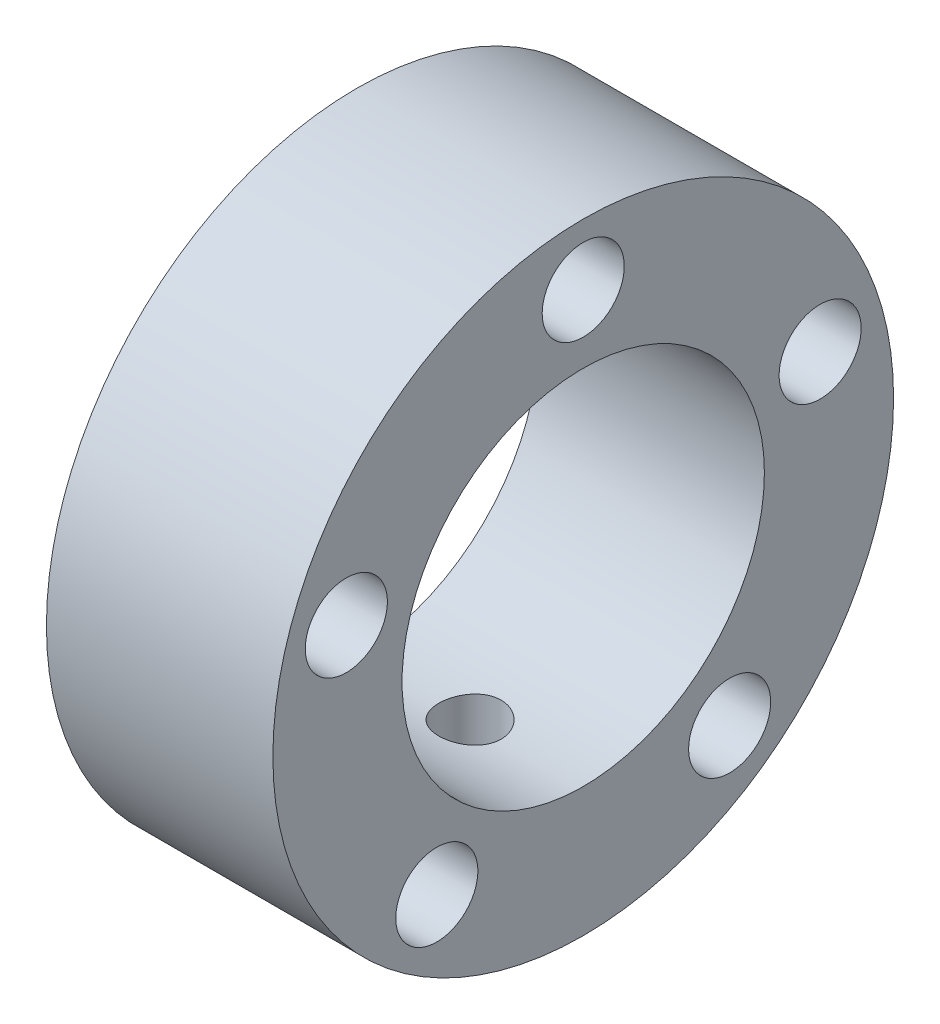
from build123d import *

# Parameters (mm, degrees)
SKETCH1_R           = 13.924461334
SKETCH1_R_2         = 8.128
BOSS_EXTRUDE1_DEPTH = 10.16
SKETCH2_R           = 1.8415
CUT_EXTRUDE1_DEPTH  = 23.158674304
SKETCH3_R           = 1.397
CUT_EXTRUDE2_DEPTH  = 23.158674304


with BuildPart() as part:
    # Sketch1 → Boss-Extrude1 (new body)
    with BuildSketch(Plane(origin=(0, 0, 0), x_dir=(0, 0, -1), z_dir=(1, 0, 0))):
        Circle(SKETCH1_R)
        Circle(SKETCH1_R_2, mode=Mode.SUBTRACT)
    extrude(amount=BOSS_EXTRUDE1_DEPTH)

    # Sketch2 → Cut-Extrude1 (cut, through all)
    with BuildSketch(Plane.ZY):
        with Locations((0, 11.176)):
            Circle(SKETCH2_R)
        with Locations((10.629007626, 3.453573929)):
            Circle(SKETCH2_R)
        with Locations((6.56908798, -9.041573929)):
            Circle(SKETCH2_R)
        with Locations((-6.56908798, -9.041573929)):
            Circle(SKETCH2_R)
        with Locations((-10.629007626, 3.453573929)):
            Circle(SKETCH2_R)
    extrude(amount=-CUT_EXTRUDE1_DEPTH, mode=Mode.SUBTRACT)

    # Sketch3 → Cut-Extrude2 (cut, through all)
    with BuildSketch(Plane(origin=(0, 0, 0), x_dir=(1, 0, 0), z_dir=(0, 1, 0))):
        with Locations((5.08, 0)):
            Circle(SKETCH3_R)
    extrude(amount=-CUT_EXTRUDE2_DEPTH, mode=Mode.SUBTRACT)


solid = part.part
